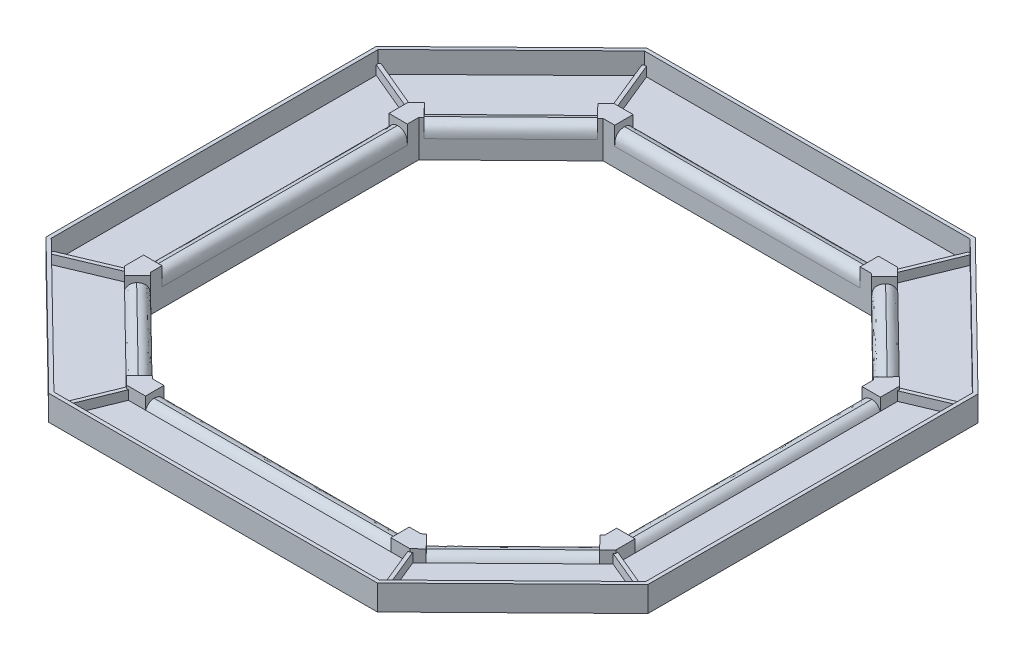
from build123d import *

# Parameters (mm, degrees)
EXTRUDE_THIN1_DEPTH  = 1.2
EXTRUDE_THIN2_DEPTH  = 4
EXTRUDE_THIN3_DEPTH  = 8
CUT_EXTRUDE1_REACH   = 225.216
EXTRUDE_THIN4_DEPTH  = 7
CUT_EXTRUDE2_REACH   = 225.743
CUT_EXTRUDE3_REACH   = 226.474
CUT_EXTRUDE4_REACH   = 225.743
CUT_EXTRUDE5_REACH   = 248.66
CUT_EXTRUDE6_REACH   = 248.66
CUT_EXTRUDE7_REACH   = 248.66
CUT_EXTRUDE8_REACH   = 248.66
FILLET11_START       = 86.4
FILLET11_OUTLINE_W   = 6
FILLET11_OUTLINE_H   = 80
FILLET11_OUTLINE_W_2 = 80
FILLET11_OUTLINE_H_2 = 6
FILLET11_DEPTH       = 4
FILLET11_START_2     = -40
FILLET11_2_DEPTH     = 80
FILLET11_START_3     = -18.895997
FILLET11_3_DEPTH     = 37.791994
FILLET11_START_4     = -21.104003
FILLET11_4_DEPTH     = 42.208006
FILLET11_START_5     = 18.895997
FILLET11_5_DEPTH     = 2.208006
FILLET11_6_DEPTH     = 2.208006
FILLET11_7_DEPTH     = 80
FILLET11_8_DEPTH     = 37.791994
FILLET11_9_DEPTH     = 42.208006
FILLET11_10_DEPTH    = 2.208006
FILLET11_11_DEPTH    = 2.208006
FILLET11_START_6     = 87.2
FILLET11_12_DEPTH    = 1.2
EXTRUDE_THIN12_DEPTH = 3


with BuildPart() as part:
    # Sketch1 → Extrude-Thin1 (new body)
    with BuildSketch(Plane(origin=(0, 88.4, 0), x_dir=(1, 0, 0), z_dir=(0, 1, 0))):
        Polygon((-53.575715, 97.5), (53.575715, 97.5), (98.136428, 53.821765), (98.136428, -53.821765), (53.575715, -97.5), (-53.575715, -97.5), (-98.136428, -53.821765), (-98.136428, 53.821765), align=None)
        Polygon((-45.408367, 77.5), (45.408367, 77.5), (78.136428, 45.420084), (78.136428, -45.420084), (45.408367, -77.5), (-45.408367, -77.5), (-78.136428, -45.420084), (-78.136428, 45.420084), align=None, mode=Mode.SUBTRACT)
    extrude(amount=-EXTRUDE_THIN1_DEPTH)



with BuildPart() as body_2:
    # Sketch3 → Extrude-Thin2 (new body)
    with BuildSketch(Plane(origin=(0, 88.4, 0), x_dir=(1, 0, 0), z_dir=(0, 1, 0))):
        Polygon((-46.225102, 79.5), (-80.136428, 46.260252), (-80.136428, -46.260252), (-46.225102, -79.5), (46.225102, -79.5), (80.136428, -46.260252), (80.136428, 46.260252), (46.225102, 79.5), align=None)
        Polygon((-43.774898, 73.5), (-74.136428, 43.739748), (-74.136428, -43.739748), (-43.774898, -73.5), (43.774898, -73.5), (74.136428, -43.739748), (74.136428, 43.739748), (43.774898, 73.5), align=None, mode=Mode.SUBTRACT)
    extrude(amount=EXTRUDE_THIN2_DEPTH)


with BuildPart() as part_1:
    add(part.part)

    add(body_2.part)  # Extrude-Thin3 merges body 2
    # Sketch4 → Extrude-Thin3 (add)
    with BuildSketch(Plane.XZ.offset(-88.4)):
        Polygon((75.336428, -44.243849), (44.264939, -74.7), (-44.264939, -74.7), (-75.336428, -44.243849), (-75.336428, 44.243849), (-44.264939, 74.7), (44.264939, 74.7), (75.336428, 44.243849), align=None)
        Polygon((74.136428, -43.739748), (43.774898, -73.5), (-43.774898, -73.5), (-74.136428, -43.739748), (-74.136428, 43.739748), (-43.774898, 73.5), (43.774898, 73.5), (74.136428, 43.739748), align=None, mode=Mode.SUBTRACT)
    extrude(amount=EXTRUDE_THIN3_DEPTH)

    # Sketch6 → Cut-Extrude1 (cut, up to next)
    with BuildSketch(Plane(origin=(80.136428, 0, 0), x_dir=(0, 0, -1), z_dir=(1, 0, 0)), mode=Mode.PRIVATE) as cut_extrude1_sk1:
        Polygon((0, 92.4), (40, 92.4), (40, 90.4), (-40, 90.4), (-40, 92.4), align=None)
    cut_extrude1_tool1 = extrude(cut_extrude1_sk1.sketch, amount=-CUT_EXTRUDE1_REACH, mode=Mode.PRIVATE) & part_1.part
    add(cut_extrude1_tool1.solids().sort_by_distance((80.136428, 91.4, 0))[0], mode=Mode.SUBTRACT)

    # Sketch9 → Extrude-Thin4 (add)
    with BuildSketch(Plane(origin=(0, 88.4, 0), x_dir=(1, 0, 0), z_dir=(0, 1, 0))):
        Polygon((98.136428, -53.821765), (98.136428, 53.821765), (53.575715, 97.5), (-53.575715, 97.5), (-98.136428, 53.821765), (-98.136428, -53.821765), (-53.575715, -97.5), (53.575715, -97.5), align=None)
        Polygon((96.936428, -53.317664), (96.936428, 53.317664), (53.085674, 96.3), (-53.085674, 96.3), (-96.936428, 53.317664), (-96.936428, -53.317664), (-53.085674, -96.3), (53.085674, -96.3), align=None, mode=Mode.SUBTRACT)
    extrude(amount=EXTRUDE_THIN4_DEPTH)

    # Sketch10 → Cut-Extrude2 (cut, up to next)
    with BuildSketch(Plane(origin=(0, 0, -79.5), x_dir=(-1, 0, 0), z_dir=(0, 0, -1)), mode=Mode.PRIVATE) as cut_extrude2_sk1:
        Polygon((0, 92.4), (40, 92.4), (40, 90.4), (-40, 90.4), (-40, 92.4), align=None)
    cut_extrude2_tool1 = extrude(cut_extrude2_sk1.sketch, amount=-CUT_EXTRUDE2_REACH, mode=Mode.PRIVATE) & part_1.part
    add(cut_extrude2_tool1.solids().sort_by_distance((0, 91.4, -79.5))[0], mode=Mode.SUBTRACT)

    # Sketch11 → Cut-Extrude3 (cut, up to next)
    with BuildSketch(Plane.ZY.offset(80.136428), mode=Mode.PRIVATE) as cut_extrude3_sk1:
        Polygon((0, 92.4), (40, 92.4), (40, 90.4), (-40, 90.4), (-40, 92.4), align=None)
    cut_extrude3_tool1 = extrude(cut_extrude3_sk1.sketch, amount=-CUT_EXTRUDE3_REACH, mode=Mode.PRIVATE) & part_1.part
    add(cut_extrude3_tool1.solids().sort_by_distance((-80.136428, 91.4, 0))[0], mode=Mode.SUBTRACT)

    # Sketch12 → Cut-Extrude4 (cut, up to next)
    with BuildSketch(Plane.XY.offset(79.5), mode=Mode.PRIVATE) as cut_extrude4_sk1:
        Polygon((0, 92.4), (40, 92.4), (40, 90.4), (-40, 90.4), (-40, 92.4), align=None)
    cut_extrude4_tool1 = extrude(cut_extrude4_sk1.sketch, amount=-CUT_EXTRUDE4_REACH, mode=Mode.PRIVATE) & part_1.part
    add(cut_extrude4_tool1.solids().sort_by_distance((0, 91.4, 79.5))[0], mode=Mode.SUBTRACT)

    # Sketch13 → Cut-Extrude5 (cut, up to next)
    with BuildSketch(Plane(origin=(62.392349, 0, -63.652928), x_dir=(-0.7141428428542849, -2.5430407990090557e-15, -0.7000000000000002), z_dir=(0.7000000000000002, -2.5944205509982273e-15, -0.7141428428542849)), mode=Mode.PRIVATE) as cut_extrude5_sk1:
        Polygon((-1.104003, 92.4), (18.895997, 92.4), (18.895997, 90.4), (-21.104003, 90.4), (-21.104003, 92.4), align=None)
    cut_extrude5_tool1 = extrude(cut_extrude5_sk1.sketch, amount=-CUT_EXTRUDE5_REACH, mode=Mode.PRIVATE) & part_1.part
    add(cut_extrude5_tool1.solids().sort_by_distance((63.180765, 91.4, -62.880126))[0], mode=Mode.SUBTRACT)

    # Sketch16 → Cut-Extrude6 (cut, up to next)
    with BuildSketch(Plane(origin=(62.392349, 0, 63.652928), x_dir=(0.7141428428542843, -2.5430407990090592e-15, -0.7000000000000008), z_dir=(0.7000000000000008, 2.594420550998226e-15, 0.7141428428542843)), mode=Mode.PRIVATE) as cut_extrude6_sk1:
        Polygon((1.104003, 92.4), (21.104003, 92.4), (21.104003, 90.4), (-18.895997, 90.4), (-18.895997, 92.4), align=None)
    cut_extrude6_tool1 = extrude(cut_extrude6_sk1.sketch, amount=-CUT_EXTRUDE6_REACH, mode=Mode.PRIVATE) & part_1.part
    add(cut_extrude6_tool1.solids().sort_by_distance((63.180765, 91.4, 62.880126))[0], mode=Mode.SUBTRACT)

    # Sketch17 → Cut-Extrude7 (cut, up to next)
    with BuildSketch(Plane(origin=(-62.392349, 0, 63.652928), x_dir=(0.7141428428542849, 2.5430407990090557e-15, 0.7000000000000002), z_dir=(-0.7000000000000002, 2.5944205509982273e-15, 0.7141428428542849)), mode=Mode.PRIVATE) as cut_extrude7_sk1:
        Polygon((-1.104003, 92.4), (18.895997, 92.4), (18.895997, 90.4), (-21.104003, 90.4), (-21.104003, 92.4), align=None)
    cut_extrude7_tool1 = extrude(cut_extrude7_sk1.sketch, amount=-CUT_EXTRUDE7_REACH, mode=Mode.PRIVATE) & part_1.part
    add(cut_extrude7_tool1.solids().sort_by_distance((-63.180765, 91.4, 62.880126))[0], mode=Mode.SUBTRACT)

    # Sketch18 → Cut-Extrude8 (cut, up to next)
    with BuildSketch(Plane(origin=(-62.392349, 0, -63.652928), x_dir=(-0.714142842854285, 2.5430407990090565e-15, 0.7000000000000001), z_dir=(-0.7000000000000001, -2.5944205509982293e-15, -0.714142842854285)), mode=Mode.PRIVATE) as cut_extrude8_sk1:
        Polygon((1.104003, 92.4), (21.104003, 92.4), (21.104003, 90.4), (-18.895997, 90.4), (-18.895997, 92.4), align=None)
    cut_extrude8_tool1 = extrude(cut_extrude8_sk1.sketch, amount=-CUT_EXTRUDE8_REACH, mode=Mode.PRIVATE) & part_1.part
    add(cut_extrude8_tool1.solids().sort_by_distance((-63.180765, 91.4, -62.880126))[0], mode=Mode.SUBTRACT)

    # Fillet11: read off the stored shape, not the designer's step
    # Fillet11 outline → Fillet11 (cut)
    with BuildSketch(Plane(origin=(0, 0, 0), x_dir=(1, 0, 0), z_dir=(0, 1, 0)).offset(FILLET11_START)):
        with Locations((77.136428, 0)):
            Rectangle(FILLET11_OUTLINE_W, FILLET11_OUTLINE_H)
        Polygon((77.463622, -48.880126), (73.263622, -44.595269), (44.697908, -72.595269), (48.897908, -76.880126), align=None)
        Polygon((44.697908, 72.595269), (73.263622, 44.595269), (77.463622, 48.880126), (48.897908, 76.880126), align=None)
        with Locations((0, -76.5)):
            Rectangle(FILLET11_OUTLINE_W_2, FILLET11_OUTLINE_H_2)
        with Locations((0, 76.5)):
            Rectangle(FILLET11_OUTLINE_W_2, FILLET11_OUTLINE_H_2)
        Polygon((-48.897908, -76.880126), (-44.697908, -72.595269), (-73.263622, -44.595269), (-77.463622, -48.880126), align=None)
        Polygon((-73.263622, 44.595269), (-44.697908, 72.595269), (-48.897908, 76.880126), (-77.463622, 48.880126), align=None)
        with Locations((-77.136428, 0)):
            Rectangle(FILLET11_OUTLINE_W, FILLET11_OUTLINE_H)
    extrude(amount=FILLET11_DEPTH, mode=Mode.SUBTRACT)

    # Fillet11 2 outline → Fillet11 2 (add)
    with BuildSketch(Plane.XY.offset(FILLET11_START_2)):
        with BuildLine():
            add(Edge.make_bspline(
                [(77.345393, 90.383652), (77.636012, 90.363489), (77.931296, 90.323287), (78.658088, 90.146359), (79.255012, 89.744494), (79.722069, 89.117691), (79.929248, 88.758846), (80.136428, 88.4)],
                knots=[0.160244, 0.160244, 0.160244, 0.160244, 0.160244, 0.160244, 0.5, 0.5, 1, 1, 1, 1, 1, 1], degree=5))
            add(Edge.make_bspline(
                [(77.345393, 90.383652), (76.822674, 90.352715), (76.295506, 90.274969), (75.50809, 90.0249), (74.926233, 89.569272), (74.549935, 88.908085), (74.444066, 88.660261), (74.360921, 88.4)],
                knots=[0.116856, 0.116856, 0.116856, 0.116856, 0.116856, 0.116856, 0.5, 0.5, 0.703135, 0.703135, 0.703135, 0.703135, 0.703135, 0.703135], degree=5))
            Line((74.360921, 88.4), (75.336428, 88.4))
            Line((75.336428, 88.4), (78.136428, 88.4))
            Line((78.136428, 88.4), (78.136428, 87.2))
            Line((78.136428, 87.2), (80.136428, 87.2))
            Line((80.136428, 87.2), (80.136428, 88.4))
        make_face()
        with BuildLine():
            Line((75.336428, 88.4), (74.360921, 88.4))
            add(Edge.make_bspline(
                [(74.360921, 88.4), (74.28778, 88.171052), (74.232225, 87.93248), (74.19304, 87.688569), (74.168042, 87.44382), (74.153312, 87.2)],
                knots=[0.703135, 0.703135, 0.703135, 0.703135, 0.703135, 0.703135, 0.88183, 0.88183, 0.88183, 0.88183, 0.88183, 0.88183], degree=5))
            Line((74.153312, 87.2), (75.336428, 87.2))
            Line((75.336428, 87.2), (75.336428, 88.4))
        make_face()
        with BuildLine():
            Line((75.336428, 87.2), (74.153312, 87.2))
            add(Edge.make_bspline(
                [(74.153312, 87.2), (74.143571, 87.038762), (74.138321, 86.877931), (74.136428, 86.718017), (74.136428, 86.559008), (74.136428, 86.4)],
                knots=[0.88183, 0.88183, 0.88183, 0.88183, 0.88183, 0.88183, 1, 1, 1, 1, 1, 1], degree=5))
            Line((74.136428, 86.4), (75.336428, 86.4))
            Line((75.336428, 86.4), (75.336428, 87.2))
        make_face()
        with BuildLine():
            Line((-75.336428, 87.2), (-74.153312, 87.2))
            add(Edge.make_bspline(
                [(-74.360921, 88.4), (-74.28778, 88.171052), (-74.232225, 87.93248), (-74.19304, 87.688569), (-74.168042, 87.44382), (-74.153312, 87.2)],
                knots=[0.703135, 0.703135, 0.703135, 0.703135, 0.703135, 0.703135, 0.88183, 0.88183, 0.88183, 0.88183, 0.88183, 0.88183], degree=5))
            Line((-74.360921, 88.4), (-75.336428, 88.4))
            Line((-75.336428, 88.4), (-75.336428, 87.2))
        make_face()
        with BuildLine():
            add(Edge.make_bspline(
                [(-74.153312, 87.2), (-74.143571, 87.038762), (-74.138321, 86.877931), (-74.136428, 86.718017), (-74.136428, 86.559008), (-74.136428, 86.4)],
                knots=[0.88183, 0.88183, 0.88183, 0.88183, 0.88183, 0.88183, 1, 1, 1, 1, 1, 1], degree=5))
            Line((-74.153312, 87.2), (-75.336428, 87.2))
            Line((-75.336428, 87.2), (-75.336428, 86.4))
            Line((-75.336428, 86.4), (-74.136428, 86.4))
        make_face()
        with BuildLine():
            Line((-75.336428, 88.4), (-74.360921, 88.4))
            add(Edge.make_bspline(
                [(-77.345396, 90.383652), (-76.822674, 90.352715), (-76.295506, 90.274969), (-75.50809, 90.0249), (-74.926233, 89.569272), (-74.549935, 88.908085), (-74.444066, 88.660261), (-74.360921, 88.4)],
                knots=[0.116856, 0.116856, 0.116856, 0.116856, 0.116856, 0.116856, 0.5, 0.5, 0.703135, 0.703135, 0.703135, 0.703135, 0.703135, 0.703135], degree=5))
            add(Edge.make_bspline(
                [(-77.345396, 90.383652), (-77.636012, 90.363489), (-77.931296, 90.323287), (-78.658088, 90.146359), (-79.255012, 89.744494), (-79.722069, 89.117691), (-79.929248, 88.758846), (-80.136428, 88.4)],
                knots=[0.160244, 0.160244, 0.160244, 0.160244, 0.160244, 0.160244, 0.5, 0.5, 1, 1, 1, 1, 1, 1], degree=5))
            Line((-80.136428, 88.4), (-80.136428, 87.2))
            Line((-80.136428, 87.2), (-78.136428, 87.2))
            Line((-78.136428, 87.2), (-78.136428, 88.4))
            Line((-78.136428, 88.4), (-75.336428, 88.4))
        make_face()
    extrude(amount=FILLET11_2_DEPTH)

    # Fillet11 3 outline → Fillet11 3 (add)
    with BuildSketch(Plane(origin=(0, 0, 0), x_dir=(0.6999999999992842, 0, -0.7141428428549866), z_dir=(0.7141428428549866, 0, 0.6999999999992842)).offset(FILLET11_START_3)):
        with BuildLine():
            add(Edge.make_bspline(
                [(-86.340893, 90.383652), (-85.818172, 90.352714), (-85.291004, 90.274969), (-84.503589, 90.0249), (-83.921732, 89.569272), (-83.545435, 88.908085), (-83.439565, 88.660261), (-83.356421, 88.4)],
                knots=[0.116856, 0.116856, 0.116856, 0.116856, 0.116856, 0.116856, 0.5, 0.5, 0.703135, 0.703135, 0.703135, 0.703135, 0.703135, 0.703135], degree=5))
            add(Edge.make_bspline(
                [(-86.340893, 90.383652), (-86.631511, 90.363489), (-86.926795, 90.323287), (-87.653587, 90.146359), (-88.250511, 89.744494), (-88.717568, 89.117691), (-88.924748, 88.758846), (-89.131927, 88.4)],
                knots=[0.160244, 0.160244, 0.160244, 0.160244, 0.160244, 0.160244, 0.5, 0.5, 1, 1, 1, 1, 1, 1], degree=5))
            Line((-89.131927, 88.4), (-89.131927, 87.2))
            Line((-89.131927, 87.2), (-87.131927, 87.2))
            Line((-87.131927, 87.2), (-87.131927, 88.4))
            Line((-87.131927, 88.4), (-84.331927, 88.4))
            Line((-84.331927, 88.4), (-83.356421, 88.4))
        make_face()
        with BuildLine():
            add(Edge.make_bspline(
                [(-83.356421, 88.4), (-83.283279, 88.171052), (-83.227724, 87.93248), (-83.18854, 87.688569), (-83.163541, 87.44382), (-83.148811, 87.2)],
                knots=[0.703135, 0.703135, 0.703135, 0.703135, 0.703135, 0.703135, 0.88183, 0.88183, 0.88183, 0.88183, 0.88183, 0.88183], degree=5))
            Line((-83.356421, 88.4), (-84.331927, 88.4))
            Line((-84.331927, 88.4), (-84.331927, 87.2))
            Line((-84.331927, 87.2), (-83.148811, 87.2))
        make_face()
        with BuildLine():
            add(Edge.make_bspline(
                [(-83.148811, 87.2), (-83.139071, 87.038762), (-83.13382, 86.877931), (-83.131927, 86.718017), (-83.131927, 86.559008), (-83.131927, 86.4)],
                knots=[0.88183, 0.88183, 0.88183, 0.88183, 0.88183, 0.88183, 1, 1, 1, 1, 1, 1], degree=5))
            Line((-83.148811, 87.2), (-84.331927, 87.2))
            Line((-84.331927, 87.2), (-84.331927, 86.4))
            Line((-84.331927, 86.4), (-83.131927, 86.4))
        make_face()
        with BuildLine():
            Line((84.331927, 87.2), (83.148811, 87.2))
            add(Edge.make_bspline(
                [(83.148811, 87.2), (83.139071, 87.038762), (83.13382, 86.877931), (83.131927, 86.718017), (83.131927, 86.559008), (83.131927, 86.4)],
                knots=[0.88183, 0.88183, 0.88183, 0.88183, 0.88183, 0.88183, 1, 1, 1, 1, 1, 1], degree=5))
            Line((83.131927, 86.4), (84.331927, 86.4))
            Line((84.331927, 86.4), (84.331927, 87.2))
        make_face()
        with BuildLine():
            add(Edge.make_bspline(
                [(83.356421, 88.4), (83.283279, 88.171052), (83.227724, 87.93248), (83.18854, 87.688569), (83.163541, 87.44382), (83.148811, 87.2)],
                knots=[0.703135, 0.703135, 0.703135, 0.703135, 0.703135, 0.703135, 0.88183, 0.88183, 0.88183, 0.88183, 0.88183, 0.88183], degree=5))
            Line((83.148811, 87.2), (84.331927, 87.2))
            Line((84.331927, 87.2), (84.331927, 88.4))
            Line((84.331927, 88.4), (83.356421, 88.4))
        make_face()
        with BuildLine():
            add(Edge.make_bspline(
                [(86.340893, 90.383652), (85.818172, 90.352714), (85.291004, 90.274969), (84.503589, 90.0249), (83.921732, 89.569272), (83.545435, 88.908085), (83.439565, 88.660261), (83.356421, 88.4)],
                knots=[0.116856, 0.116856, 0.116856, 0.116856, 0.116856, 0.116856, 0.5, 0.5, 0.703135, 0.703135, 0.703135, 0.703135, 0.703135, 0.703135], degree=5))
            Line((83.356421, 88.4), (84.331927, 88.4))
            Line((84.331927, 88.4), (87.131927, 88.4))
            Line((87.131927, 88.4), (87.131927, 87.2))
            Line((87.131927, 87.2), (89.131927, 87.2))
            Line((89.131927, 87.2), (89.131927, 88.4))
            add(Edge.make_bspline(
                [(86.340893, 90.383652), (86.631511, 90.363489), (86.926795, 90.323287), (87.653587, 90.146359), (88.250511, 89.744494), (88.717568, 89.117691), (88.924748, 88.758846), (89.131927, 88.4)],
                knots=[0.160244, 0.160244, 0.160244, 0.160244, 0.160244, 0.160244, 0.5, 0.5, 1, 1, 1, 1, 1, 1], degree=5))
        make_face()
    extrude(amount=FILLET11_3_DEPTH)

    # Fillet11 4 outline → Fillet11 4 (add)
    with BuildSketch(Plane(origin=(0, 0, 0), x_dir=(0.6999999999992842, 0, -0.7141428428549866), z_dir=(0.7141428428549866, 0, 0.6999999999992842)).offset(FILLET11_START_4)):
        with BuildLine():
            add(Edge.make_bspline(
                [(-86.340893, 90.383652), (-85.818172, 90.352714), (-85.291004, 90.274969), (-84.503589, 90.0249), (-83.921732, 89.569272), (-83.545435, 88.908085), (-83.439565, 88.660261), (-83.356421, 88.4)],
                knots=[0.116856, 0.116856, 0.116856, 0.116856, 0.116856, 0.116856, 0.5, 0.5, 0.703135, 0.703135, 0.703135, 0.703135, 0.703135, 0.703135], degree=5))
            add(Edge.make_bspline(
                [(-86.340893, 90.383652), (-86.631511, 90.363489), (-86.926795, 90.323287), (-87.653587, 90.146359), (-88.250511, 89.744494), (-88.717568, 89.117691), (-88.924748, 88.758846), (-89.131927, 88.4)],
                knots=[0.160244, 0.160244, 0.160244, 0.160244, 0.160244, 0.160244, 0.5, 0.5, 1, 1, 1, 1, 1, 1], degree=5))
            Line((-89.131927, 88.4), (-89.131927, 87.2))
            Line((-89.131927, 87.2), (-87.131927, 87.2))
            Line((-87.131927, 87.2), (-87.131927, 88.4))
            Line((-87.131927, 88.4), (-83.356421, 88.4))
        make_face()
        with BuildLine():
            add(Edge.make_bspline(
                [(86.340893, 90.383652), (85.818172, 90.352714), (85.291004, 90.274969), (84.503589, 90.0249), (83.921732, 89.569272), (83.545435, 88.908085), (83.439565, 88.660261), (83.356421, 88.4)],
                knots=[0.116856, 0.116856, 0.116856, 0.116856, 0.116856, 0.116856, 0.5, 0.5, 0.703135, 0.703135, 0.703135, 0.703135, 0.703135, 0.703135], degree=5))
            Line((83.356421, 88.4), (87.131927, 88.4))
            Line((87.131927, 88.4), (87.131927, 87.2))
            Line((87.131927, 87.2), (89.131927, 87.2))
            Line((89.131927, 87.2), (89.131927, 88.4))
            add(Edge.make_bspline(
                [(86.340893, 90.383652), (86.631511, 90.363489), (86.926795, 90.323287), (87.653587, 90.146359), (88.250511, 89.744494), (88.717568, 89.117691), (88.924748, 88.758846), (89.131927, 88.4)],
                knots=[0.160244, 0.160244, 0.160244, 0.160244, 0.160244, 0.160244, 0.5, 0.5, 1, 1, 1, 1, 1, 1], degree=5))
        make_face()
    extrude(amount=FILLET11_4_DEPTH)

    # Fillet11 5 outline → Fillet11 5 (add)
    with BuildSketch(Plane(origin=(0, 0, 0), x_dir=(0.6999999999992842, 0, -0.7141428428549866), z_dir=(0.7141428428549866, 0, 0.6999999999992842)).offset(FILLET11_START_5)):
        with BuildLine():
            Line((84.331927, 86.4), (84.331927, 88.4))
            Line((84.331927, 88.4), (83.356421, 88.4))
            add(Edge.make_bspline(
                [(83.356421, 88.4), (83.234911, 88.019649), (83.161938, 87.612736), (83.131927, 87.198915), (83.131927, 86.799457), (83.131927, 86.4)],
                knots=[0.703135, 0.703135, 0.703135, 0.703135, 0.703135, 0.703135, 1, 1, 1, 1, 1, 1], degree=5))
            Line((83.131927, 86.4), (84.331927, 86.4))
        make_face()
    extrude(amount=FILLET11_5_DEPTH)

    # Fillet11 6 outline → Fillet11 6 (add)
    with BuildSketch(Plane(origin=(0, 0, 0), x_dir=(0.6999999999992842, 0, -0.7141428428549866), z_dir=(0.7141428428549866, 0, 0.6999999999992842)).offset(FILLET11_START_4)):
        with BuildLine():
            Line((-83.356421, 88.4), (-84.331927, 88.4))
            Line((-84.331927, 88.4), (-84.331927, 86.4))
            Line((-84.331927, 86.4), (-83.131927, 86.4))
            add(Edge.make_bspline(
                [(-83.131927, 86.4), (-83.131927, 86.799457), (-83.131927, 87.198915), (-83.161938, 87.612736), (-83.234911, 88.019649), (-83.356421, 88.4)],
                knots=[0.88183, 0.88183, 0.88183, 0.88183, 0.88183, 0.88183, 1.178695, 1.178695, 1.178695, 1.178695, 1.178695, 1.178695], degree=5))
        make_face()
    extrude(amount=FILLET11_6_DEPTH)

    # Fillet11 7 outline → Fillet11 7 (add)
    with BuildSketch(Plane.YZ.offset(FILLET11_START_2)):
        with BuildLine():
            add(Edge.make_bspline(
                [(90.383652, 76.708968), (90.352715, 76.186246), (90.274969, 75.659078), (90.0249, 74.871662), (89.569272, 74.289805), (88.908085, 73.913507), (88.660261, 73.807638), (88.4, 73.724493)],
                knots=[0.116856, 0.116856, 0.116856, 0.116856, 0.116856, 0.116856, 0.5, 0.5, 0.703135, 0.703135, 0.703135, 0.703135, 0.703135, 0.703135], degree=5))
            add(Edge.make_bspline(
                [(90.383652, 76.708968), (90.363489, 76.999584), (90.323287, 77.294868), (90.146359, 78.02166), (89.744494, 78.618584), (89.117691, 79.085641), (88.758846, 79.29282), (88.4, 79.5)],
                knots=[0.160244, 0.160244, 0.160244, 0.160244, 0.160244, 0.160244, 0.5, 0.5, 1, 1, 1, 1, 1, 1], degree=5))
            Line((88.4, 79.5), (87.2, 79.5))
            Line((87.2, 79.5), (87.2, 77.5))
            Line((87.2, 77.5), (88.4, 77.5))
            Line((88.4, 77.5), (88.4, 74.7))
            Line((88.4, 74.7), (88.4, 73.724493))
        make_face()
        with BuildLine():
            add(Edge.make_bspline(
                [(88.4, 73.724493), (88.171052, 73.651352), (87.93248, 73.595797), (87.688569, 73.556612), (87.44382, 73.531614), (87.2, 73.516884)],
                knots=[0.703135, 0.703135, 0.703135, 0.703135, 0.703135, 0.703135, 0.88183, 0.88183, 0.88183, 0.88183, 0.88183, 0.88183], degree=5))
            Line((88.4, 73.724493), (88.4, 74.7))
            Line((88.4, 74.7), (87.2, 74.7))
            Line((87.2, 74.7), (87.2, 73.516884))
        make_face()
        with BuildLine():
            add(Edge.make_bspline(
                [(87.2, 73.516884), (87.038762, 73.507143), (86.877931, 73.501893), (86.718017, 73.5), (86.559008, 73.5), (86.4, 73.5)],
                knots=[0.88183, 0.88183, 0.88183, 0.88183, 0.88183, 0.88183, 1, 1, 1, 1, 1, 1], degree=5))
            Line((87.2, 73.516884), (87.2, 74.7))
            Line((87.2, 74.7), (86.4, 74.7))
            Line((86.4, 74.7), (86.4, 73.5))
        make_face()
        with BuildLine():
            Line((87.2, -74.7), (87.2, -73.516884))
            add(Edge.make_bspline(
                [(87.2, -73.516884), (87.038762, -73.507143), (86.877931, -73.501893), (86.718017, -73.5), (86.559008, -73.5), (86.4, -73.5)],
                knots=[0.88183, 0.88183, 0.88183, 0.88183, 0.88183, 0.88183, 1, 1, 1, 1, 1, 1], degree=5))
            Line((86.4, -73.5), (86.4, -74.7))
            Line((86.4, -74.7), (87.2, -74.7))
        make_face()
        with BuildLine():
            add(Edge.make_bspline(
                [(88.4, -73.724493), (88.171052, -73.651352), (87.93248, -73.595797), (87.688569, -73.556612), (87.44382, -73.531614), (87.2, -73.516884)],
                knots=[0.703135, 0.703135, 0.703135, 0.703135, 0.703135, 0.703135, 0.88183, 0.88183, 0.88183, 0.88183, 0.88183, 0.88183], degree=5))
            Line((87.2, -73.516884), (87.2, -74.7))
            Line((87.2, -74.7), (88.4, -74.7))
            Line((88.4, -74.7), (88.4, -73.724493))
        make_face()
        with BuildLine():
            add(Edge.make_bspline(
                [(90.383652, -76.708968), (90.352715, -76.186246), (90.274969, -75.659078), (90.0249, -74.871662), (89.569272, -74.289805), (88.908085, -73.913507), (88.660261, -73.807638), (88.4, -73.724493)],
                knots=[0.116856, 0.116856, 0.116856, 0.116856, 0.116856, 0.116856, 0.5, 0.5, 0.703135, 0.703135, 0.703135, 0.703135, 0.703135, 0.703135], degree=5))
            Line((88.4, -73.724493), (88.4, -74.7))
            Line((88.4, -74.7), (88.4, -77.5))
            Line((88.4, -77.5), (87.2, -77.5))
            Line((87.2, -77.5), (87.2, -79.5))
            Line((87.2, -79.5), (88.4, -79.5))
            add(Edge.make_bspline(
                [(90.383652, -76.708968), (90.363489, -76.999584), (90.323287, -77.294868), (90.146359, -78.02166), (89.744494, -78.618584), (89.117691, -79.085641), (88.758846, -79.29282), (88.4, -79.5)],
                knots=[0.160244, 0.160244, 0.160244, 0.160244, 0.160244, 0.160244, 0.5, 0.5, 1, 1, 1, 1, 1, 1], degree=5))
        make_face()
    extrude(amount=FILLET11_7_DEPTH)

    # Fillet11 8 outline → Fillet11 8 (add)
    with BuildSketch(Plane(origin=(0, 0, 0), x_dir=(0.6999999999979382, 0, 0.7141428428563061), z_dir=(0.714142842856306, 0, -0.6999999999979383)).offset(FILLET11_START_3)):
        with BuildLine():
            add(Edge.make_bspline(
                [(86.340893, -90.383652), (85.818172, -90.352714), (85.291004, -90.274969), (84.503589, -90.0249), (83.921732, -89.569272), (83.545435, -88.908085), (83.439565, -88.660261), (83.356421, -88.4)],
                knots=[0.116856, 0.116856, 0.116856, 0.116856, 0.116856, 0.116856, 0.5, 0.5, 0.703135, 0.703135, 0.703135, 0.703135, 0.703135, 0.703135], degree=5))
            add(Edge.make_bspline(
                [(86.340893, -90.383652), (86.631511, -90.363489), (86.926795, -90.323287), (87.653587, -90.146359), (88.250511, -89.744494), (88.717568, -89.117691), (88.924748, -88.758846), (89.131927, -88.4)],
                knots=[0.160244, 0.160244, 0.160244, 0.160244, 0.160244, 0.160244, 0.5, 0.5, 1, 1, 1, 1, 1, 1], degree=5))
            Line((89.131927, -88.4), (89.131927, -87.2))
            Line((89.131927, -87.2), (87.131927, -87.2))
            Line((87.131927, -87.2), (87.131927, -88.4))
            Line((87.131927, -88.4), (84.331927, -88.4))
            Line((84.331927, -88.4), (83.356421, -88.4))
        make_face()
        with BuildLine():
            add(Edge.make_bspline(
                [(83.356421, -88.4), (83.283279, -88.171052), (83.227724, -87.93248), (83.18854, -87.688569), (83.163541, -87.44382), (83.148811, -87.2)],
                knots=[0.703135, 0.703135, 0.703135, 0.703135, 0.703135, 0.703135, 0.88183, 0.88183, 0.88183, 0.88183, 0.88183, 0.88183], degree=5))
            Line((83.356421, -88.4), (84.331927, -88.4))
            Line((84.331927, -88.4), (84.331927, -87.2))
            Line((84.331927, -87.2), (83.148811, -87.2))
        make_face()
        with BuildLine():
            add(Edge.make_bspline(
                [(83.148811, -87.2), (83.139071, -87.038762), (83.13382, -86.877931), (83.131927, -86.718017), (83.131927, -86.559008), (83.131927, -86.4)],
                knots=[0.88183, 0.88183, 0.88183, 0.88183, 0.88183, 0.88183, 1, 1, 1, 1, 1, 1], degree=5))
            Line((83.148811, -87.2), (84.331927, -87.2))
            Line((84.331927, -87.2), (84.331927, -86.4))
            Line((84.331927, -86.4), (83.131927, -86.4))
        make_face()
        with BuildLine():
            Line((-84.331927, -87.2), (-83.148811, -87.2))
            add(Edge.make_bspline(
                [(-83.148811, -87.2), (-83.139071, -87.038762), (-83.13382, -86.877931), (-83.131927, -86.718017), (-83.131927, -86.559008), (-83.131927, -86.4)],
                knots=[0.88183, 0.88183, 0.88183, 0.88183, 0.88183, 0.88183, 1, 1, 1, 1, 1, 1], degree=5))
            Line((-83.131927, -86.4), (-84.331927, -86.4))
            Line((-84.331927, -86.4), (-84.331927, -87.2))
        make_face()
        with BuildLine():
            add(Edge.make_bspline(
                [(-83.356421, -88.4), (-83.283279, -88.171052), (-83.227724, -87.93248), (-83.18854, -87.688569), (-83.163541, -87.44382), (-83.148811, -87.2)],
                knots=[0.703135, 0.703135, 0.703135, 0.703135, 0.703135, 0.703135, 0.88183, 0.88183, 0.88183, 0.88183, 0.88183, 0.88183], degree=5))
            Line((-83.148811, -87.2), (-84.331927, -87.2))
            Line((-84.331927, -87.2), (-84.331927, -88.4))
            Line((-84.331927, -88.4), (-83.356421, -88.4))
        make_face()
        with BuildLine():
            add(Edge.make_bspline(
                [(-86.340893, -90.383652), (-85.818172, -90.352714), (-85.291004, -90.274969), (-84.503589, -90.0249), (-83.921732, -89.569272), (-83.545435, -88.908085), (-83.439565, -88.660261), (-83.356421, -88.4)],
                knots=[0.116856, 0.116856, 0.116856, 0.116856, 0.116856, 0.116856, 0.5, 0.5, 0.703135, 0.703135, 0.703135, 0.703135, 0.703135, 0.703135], degree=5))
            Line((-83.356421, -88.4), (-84.331927, -88.4))
            Line((-84.331927, -88.4), (-87.131927, -88.4))
            Line((-87.131927, -88.4), (-87.131927, -87.2))
            Line((-87.131927, -87.2), (-89.131927, -87.2))
            Line((-89.131927, -87.2), (-89.131927, -88.4))
            add(Edge.make_bspline(
                [(-86.340893, -90.383652), (-86.631511, -90.363489), (-86.926795, -90.323287), (-87.653587, -90.146359), (-88.250511, -89.744494), (-88.717568, -89.117691), (-88.924748, -88.758846), (-89.131927, -88.4)],
                knots=[0.160244, 0.160244, 0.160244, 0.160244, 0.160244, 0.160244, 0.5, 0.5, 1, 1, 1, 1, 1, 1], degree=5))
        make_face()
    extrude(amount=FILLET11_8_DEPTH)

    # Fillet11 9 outline → Fillet11 9 (add)
    with BuildSketch(Plane(origin=(0, 0, 0), x_dir=(0.6999999999979382, 0, 0.7141428428563061), z_dir=(0.714142842856306, 0, -0.6999999999979383)).offset(FILLET11_START_4)):
        with BuildLine():
            add(Edge.make_bspline(
                [(86.340893, -90.383652), (85.818172, -90.352714), (85.291004, -90.274969), (84.503589, -90.0249), (83.921732, -89.569272), (83.545435, -88.908085), (83.439565, -88.660261), (83.356421, -88.4)],
                knots=[0.116856, 0.116856, 0.116856, 0.116856, 0.116856, 0.116856, 0.5, 0.5, 0.703135, 0.703135, 0.703135, 0.703135, 0.703135, 0.703135], degree=5))
            add(Edge.make_bspline(
                [(86.340893, -90.383652), (86.631511, -90.363489), (86.926795, -90.323287), (87.653587, -90.146359), (88.250511, -89.744494), (88.717568, -89.117691), (88.924748, -88.758846), (89.131927, -88.4)],
                knots=[0.160244, 0.160244, 0.160244, 0.160244, 0.160244, 0.160244, 0.5, 0.5, 1, 1, 1, 1, 1, 1], degree=5))
            Line((89.131927, -88.4), (89.131927, -87.2))
            Line((89.131927, -87.2), (87.131927, -87.2))
            Line((87.131927, -87.2), (87.131927, -88.4))
            Line((87.131927, -88.4), (83.356421, -88.4))
        make_face()
        with BuildLine():
            add(Edge.make_bspline(
                [(-86.340893, -90.383652), (-85.818172, -90.352714), (-85.291004, -90.274969), (-84.503589, -90.0249), (-83.921732, -89.569272), (-83.545435, -88.908085), (-83.439565, -88.660261), (-83.356421, -88.4)],
                knots=[0.116856, 0.116856, 0.116856, 0.116856, 0.116856, 0.116856, 0.5, 0.5, 0.703135, 0.703135, 0.703135, 0.703135, 0.703135, 0.703135], degree=5))
            Line((-83.356421, -88.4), (-87.131927, -88.4))
            Line((-87.131927, -88.4), (-87.131927, -87.2))
            Line((-87.131927, -87.2), (-89.131927, -87.2))
            Line((-89.131927, -87.2), (-89.131927, -88.4))
            add(Edge.make_bspline(
                [(-86.340893, -90.383652), (-86.631511, -90.363489), (-86.926795, -90.323287), (-87.653587, -90.146359), (-88.250511, -89.744494), (-88.717568, -89.117691), (-88.924748, -88.758846), (-89.131927, -88.4)],
                knots=[0.160244, 0.160244, 0.160244, 0.160244, 0.160244, 0.160244, 0.5, 0.5, 1, 1, 1, 1, 1, 1], degree=5))
        make_face()
    extrude(amount=FILLET11_9_DEPTH)

    # Fillet11 10 outline → Fillet11 10 (add)
    with BuildSketch(Plane(origin=(0, 0, 0), x_dir=(0.6999999999979382, 0, 0.7141428428563061), z_dir=(0.714142842856306, 0, -0.6999999999979383)).offset(FILLET11_START_5)):
        with BuildLine():
            Line((83.356421, -88.4), (84.331927, -88.4))
            Line((84.331927, -88.4), (84.331927, -86.4))
            Line((84.331927, -86.4), (83.131927, -86.4))
            add(Edge.make_bspline(
                [(83.131927, -86.4), (83.131927, -86.799457), (83.131927, -87.198915), (83.161938, -87.612736), (83.234911, -88.019649), (83.356421, -88.4)],
                knots=[0.88183, 0.88183, 0.88183, 0.88183, 0.88183, 0.88183, 1.178695, 1.178695, 1.178695, 1.178695, 1.178695, 1.178695], degree=5))
        make_face()
    extrude(amount=FILLET11_10_DEPTH)

    # Fillet11 11 outline → Fillet11 11 (add)
    with BuildSketch(Plane(origin=(0, 0, 0), x_dir=(0.6999999999979382, 0, 0.7141428428563061), z_dir=(0.714142842856306, 0, -0.6999999999979383)).offset(FILLET11_START_4)):
        with BuildLine():
            Line((-84.331927, -86.4), (-84.331927, -88.4))
            Line((-84.331927, -88.4), (-83.356421, -88.4))
            add(Edge.make_bspline(
                [(-83.356421, -88.4), (-83.234911, -88.019649), (-83.161938, -87.612736), (-83.131927, -87.198915), (-83.131927, -86.799457), (-83.131927, -86.4)],
                knots=[0.703135, 0.703135, 0.703135, 0.703135, 0.703135, 0.703135, 1, 1, 1, 1, 1, 1], degree=5))
            Line((-83.131927, -86.4), (-84.331927, -86.4))
        make_face()
    extrude(amount=FILLET11_11_DEPTH)

    # Fillet11 12 outline → Fillet11 12 (add)
    with BuildSketch(Plane(origin=(0, 0, 0), x_dir=(1, 0, 0), z_dir=(0, 1, 0)).offset(FILLET11_START_6)):
        Polygon((-48.897908, -76.880126), (-47.497908, -75.45184), (-76.063622, -47.45184), (-77.463622, -48.880126), align=None)
        Polygon((76.063622, -47.45184), (47.497908, -75.45184), (48.897908, -76.880126), (77.463622, -48.880126), align=None)
        Polygon((-77.463622, 48.880126), (-76.063622, 47.45184), (-47.497908, 75.45184), (-48.897908, 76.880126), align=None)
        Polygon((47.497908, 75.45184), (76.063622, 47.45184), (77.463622, 48.880126), (48.897908, 76.880126), align=None)
    extrude(amount=FILLET11_12_DEPTH)

    # Sketch23 → Extrude-Thin12 (add)
    with BuildSketch(Plane(origin=(0, 88.4, 0), x_dir=(1, 0, 0), z_dir=(0, 1, 0))):
        Polygon((77.629784, 44.55646), (97.629784, 52.95814), (97.165026, 54.064486), (77.165026, 45.662805), align=None)
        Polygon((45.662825, 76.536055), (53.830172, 96.536055), (52.719234, 96.989726), (44.551887, 76.989726), align=None)
        Polygon((-44.551887, 76.989726), (-52.719234, 96.989726), (-53.830172, 96.536055), (-45.662825, 76.536055), align=None)
        Polygon((-77.165026, 45.662805), (-97.165026, 54.064486), (-97.629784, 52.95814), (-77.629784, 44.55646), align=None)
        Polygon((-77.629784, -44.55646), (-97.629784, -52.95814), (-97.165026, -54.064486), (-77.165026, -45.662805), align=None)
        Polygon((-45.662825, -76.536055), (-53.830172, -96.536055), (-52.719234, -96.989726), (-44.551887, -76.989726), align=None)
        Polygon((44.551887, -76.989726), (52.719234, -96.989726), (53.830172, -96.536055), (45.662825, -76.536055), align=None)
        Polygon((77.165026, -45.662805), (97.165026, -54.064486), (97.629784, -52.95814), (77.629784, -44.55646), align=None)
    extrude(amount=EXTRUDE_THIN12_DEPTH)


solid = part_1.part
